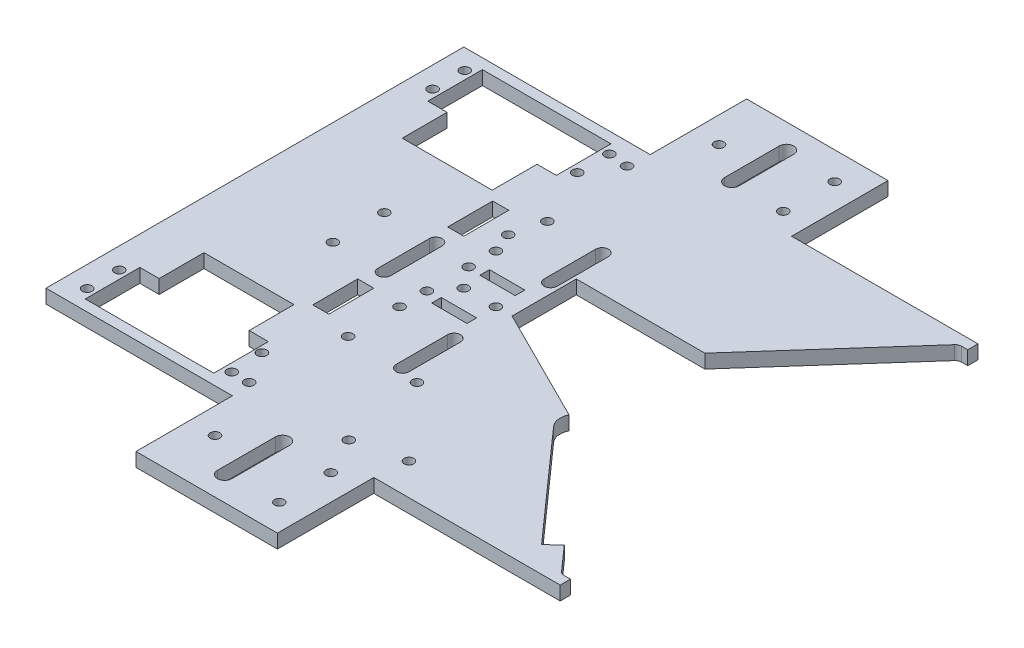
from build123d import *

# Parameters (mm, degrees)
BOSS_EXTRUDE1_DEPTH = 4.3
CUT_EXTRUDE1_DEPTH  = 4.5
FILLET1_R           = 2
CUT_EXTRUDE2_DEPTH  = 10
SKETCH8_R           = 1.5
CUT_EXTRUDE3_DEPTH  = 10
SKETCH9_R           = 1.5
CUT_EXTRUDE4_DEPTH  = 10
CUT_EXTRUDE5_DEPTH  = 10
SKETCH11_R          = 1.5
CUT_EXTRUDE6_DEPTH  = 10
SKETCH12_R          = 1.5
CUT_EXTRUDE7_DEPTH  = 10
SKETCH7_R           = 1.5
SKETCH7_W           = 11
SKETCH7_H           = 3
CUT_EXTRUDE8_DEPTH  = 9
SKETCH13_R          = 1.5
CUT_EXTRUDE9_DEPTH  = 10
SKETCH14_R          = 1.5
CUT_EXTRUDE10_DEPTH = 10
SKETCH15_W          = 5
SKETCH15_H          = 14
CUT_EXTRUDE11_DEPTH = 10
SKETCH16_R          = 1.5
CUT_EXTRUDE12_DEPTH = 10


with BuildPart() as part:
    # Sketch2 → Boss-Extrude1 (new body)
    with BuildSketch(Plane(origin=(0, 0, 0), x_dir=(1, 0, 0), z_dir=(0, 1, 0))):
        Polygon((0, 0), (0, 65), (58, 65), (58, 95), (102, 95), (102, 65), (160, 65), (160, 0), align=None)
    extrude(amount=BOSS_EXTRUDE1_DEPTH)

    # Mirror1: part across plane


with BuildPart() as part_1:
    add(part.part)
    add(part.part.mirror(Plane(origin=(0, 4.3, 0), x_dir=(1, 0, 0), z_dir=(0, 0, -1))))

    # Sketch3 → Cut-Extrude1 (cut)
    with BuildSketch(Plane(origin=(0, 4.3, 0), x_dir=(1, 0, 0), z_dir=(0, 1, 0))):
        Polygon((160, -61.8), (160, 61.8), (157.156451185, 61.8), (120.012594795, 20), (80.012594795, 20), (80.012594795, 0), (120, -20), (157.155555556, -61.8), align=None)
    extrude(amount=-CUT_EXTRUDE1_DEPTH, mode=Mode.SUBTRACT)

    # Fillet1
    fillet1_edges = [part_1.edges().sort_by_distance(p)[0] for p in [
        (157.156451185, 2.15, -61.8),
        (157.155555556, 2.15, 61.8),
    ]]
    fillet(fillet1_edges, radius=FILLET1_R)

    # Sketch6 → Cut-Extrude2 (cut)
    with BuildSketch(Plane(origin=(0, 4.3, 0), x_dir=(1, 0, 0), z_dir=(0, 1, 0))):
        Polygon((9, -61.8), (49, -61.8), (49, -44.8), (43, -44.8), (43, -30.841820122), (15, -30.841820122), (15, -44.8), (9, -44.8), align=None)
        Polygon((9, 44.8), (15, 44.8), (15, 30.841820122), (43, 30.841820122), (43, 44.8), (49, 44.8), (49, 61.8), (9, 61.8), align=None)
    extrude(amount=-CUT_EXTRUDE2_DEPTH, mode=Mode.SUBTRACT)

    # Sketch8 → Cut-Extrude3 (cut)
    with BuildSketch(Plane(origin=(0, 4.3, 0), x_dir=(1, 0, 0), z_dir=(0, 1, 0))):
        with Locations((6.5, 58.8)):
            Circle(SKETCH8_R)
        with Locations((6.5, 48.8)):
            Circle(SKETCH8_R)
        with Locations((51.5, 48.8)):
            Circle(SKETCH8_R)
        with Locations((51.5, 58.8)):
            Circle(SKETCH8_R)
        with Locations((6.5, -48.7)):
            Circle(SKETCH8_R)
        with Locations((6.5, -58.7)):
            Circle(SKETCH8_R)
        with Locations((51.5, -58.7)):
            Circle(SKETCH8_R)
        with Locations((51, -48.8)):
            Circle(SKETCH8_R)
    extrude(amount=-CUT_EXTRUDE3_DEPTH, mode=Mode.SUBTRACT)

    # Sketch9 → Cut-Extrude4 (cut)
    with BuildSketch(Plane.XZ):
        with Locations((94, 70.4)):
            Circle(SKETCH9_R)
        with Locations((66, 78.4)):
            Circle(SKETCH9_R)
        with Locations((66, -78.4)):
            Circle(SKETCH9_R)
        with Locations((94, -86.4)):
            Circle(SKETCH9_R)
        with Locations((94, 86.4)):
            Circle(SKETCH9_R)
        with Locations((94, -70.4)):
            Circle(SKETCH9_R)
        with BuildLine():
            Line((75.75, 69.4), (75.75, 87.4))
            ThreePointArc((75.75, 87.4), (78, 89.65), (80.25, 87.4))
            Line((80.25, 87.4), (80.25, 69.4))
            ThreePointArc((80.25, 69.4), (78, 67.15), (75.75, 69.4))
        make_face()
        with BuildLine():
            Line((75.75, -87.4), (75.75, -70.4))
            ThreePointArc((75.75, -70.4), (78, -68.15), (80.25, -70.4))
            Line((80.25, -70.4), (80.25, -87.4))
            ThreePointArc((80.25, -87.4), (78, -89.65), (75.75, -87.4))
        make_face()
    extrude(amount=-CUT_EXTRUDE4_DEPTH, mode=Mode.SUBTRACT)

    # Sketch10 → Cut-Extrude5 (cut)
    with BuildSketch(Plane(origin=(0, 4.3, 0), x_dir=(1, 0, 0), z_dir=(0, 1, 0))):
        with BuildLine():
            Line((123.321819194, -23.737046593), (149.896372747, -53.633419341))
            Line((149.896372747, -53.633419341), (146.159326154, -56.955238535))
            Line((146.159326154, -56.955238535), (116.262953407, -23.321819194))
            ThreePointArc((116.262953407, -23.321819194), (120.29361011, -15.008628134), (123.321819194, -23.737046593))
        make_face()
    extrude(amount=-CUT_EXTRUDE5_DEPTH, mode=Mode.SUBTRACT)

    # Sketch11 → Cut-Extrude6 (cut)
    with BuildSketch(Plane.XZ):
        with BuildLine():
            ThreePointArc((79, 31.031280577), (77, 33.031280577), (75, 31.031280577))
            Line((75, 31.031280577), (75, 15.031280577))
            ThreePointArc((75, 15.031280577), (77, 13.031280577), (79, 15.031280577))
            Line((79, 15.031280577), (79, 31.031280577))
        make_face()
        with BuildLine():
            ThreePointArc((75, -31.031280577), (77, -33.031280577), (79, -31.031280577))
            Line((79, -31.031280577), (79, -15.031280577))
            ThreePointArc((79, -15.031280577), (77, -13.031280577), (75, -15.031280577))
            Line((75, -15.031280577), (75, -31.031280577))
        make_face()
        with Locations((60, 31)):
            Circle(SKETCH11_R)
        with Locations((60, 15)):
            Circle(SKETCH11_R)
        with Locations((60, -15)):
            Circle(SKETCH11_R)
        with Locations((60, -31)):
            Circle(SKETCH11_R)
    extrude(amount=-CUT_EXTRUDE6_DEPTH, mode=Mode.SUBTRACT)

    # Sketch12 → Cut-Extrude7 (cut)
    with BuildSketch(Plane(origin=(0, 0, 0), x_dir=(-1, 0, 0), z_dir=(0, -1, 0))):
        with BuildLine():
            ThreePointArc((-50.262723036, -8), (-48.262723036, -10), (-46.262723036, -8))
            Line((-46.262723036, -8), (-46.262723036, 8))
            ThreePointArc((-46.262723036, 8), (-48.262723036, 10), (-50.262723036, 8))
            Line((-50.262723036, 8), (-50.262723036, -8))
        make_face()
        with Locations((-32.262723036, -8)):
            Circle(SKETCH12_R)
        with Locations((-32.262723036, 8)):
            Circle(SKETCH12_R)
    extrude(amount=-CUT_EXTRUDE7_DEPTH, mode=Mode.SUBTRACT)

    # Sketch7 → Cut-Extrude8 (cut)
    with BuildSketch(Plane(origin=(0, 4.3, 0), x_dir=(1, 0, 0), z_dir=(0, 1, 0))):
        with Locations((60.012594795, -6.5)):
            Circle(SKETCH7_R)
        with Locations((60.012594795, 6.5)):
            Circle(SKETCH7_R)
        with Locations((69.5, -7.5)):
            Rectangle(SKETCH7_W, SKETCH7_H)
        with Locations((69.5, 7.5)):
            Rectangle(SKETCH7_W, SKETCH7_H)
    extrude(amount=-CUT_EXTRUDE8_DEPTH, mode=Mode.SUBTRACT)

    # Sketch13 → Cut-Extrude9 (cut)
    with BuildSketch(Plane(origin=(0, 4.3, 0), x_dir=(1, 0, 0), z_dir=(0, 1, 0))):
        with Locations((75, 0)):
            Circle(SKETCH13_R)
        with Locations((65, 0)):
            Circle(SKETCH13_R)
    extrude(amount=-CUT_EXTRUDE9_DEPTH, mode=Mode.SUBTRACT)

    # Sketch14 → Cut-Extrude10 (cut)
    with BuildSketch(Plane(origin=(0, 4.3, 0), x_dir=(1, 0, 0), z_dir=(0, 1, 0))):
        with Locations((57.5, 58.3)):
            Circle(SKETCH14_R)
        with Locations((57.5, 21.3)):
            Circle(SKETCH14_R)
        with Locations((83.127806945, -32.705958418)):
            Circle(SKETCH14_R)
        with Locations((103.05872211, -55.128237978)):
            Circle(SKETCH14_R)
    extrude(amount=-CUT_EXTRUDE10_DEPTH, mode=Mode.SUBTRACT)

    # Sketch15 → Cut-Extrude11 (cut)
    with BuildSketch(Plane(origin=(0, 4.3, 0), x_dir=(1, 0, 0), z_dir=(0, 1, 0))):
        with Locations((48.5, 21)):
            Rectangle(SKETCH15_W, SKETCH15_H)
        with Locations((48.5, -21)):
            Rectangle(SKETCH15_W, SKETCH15_H)
    extrude(amount=-CUT_EXTRUDE11_DEPTH, mode=Mode.SUBTRACT)

    # Sketch16 → Cut-Extrude12 (cut)
    with BuildSketch(Plane(origin=(0, 4.3, 0), x_dir=(1, 0, 0), z_dir=(0, 1, 0))):
        with Locations((88, -58.8)):
            Circle(SKETCH16_R)
        with Locations((57, -58.8)):
            Circle(SKETCH16_R)
    extrude(amount=-CUT_EXTRUDE12_DEPTH, mode=Mode.SUBTRACT)


solid = part_1.part
